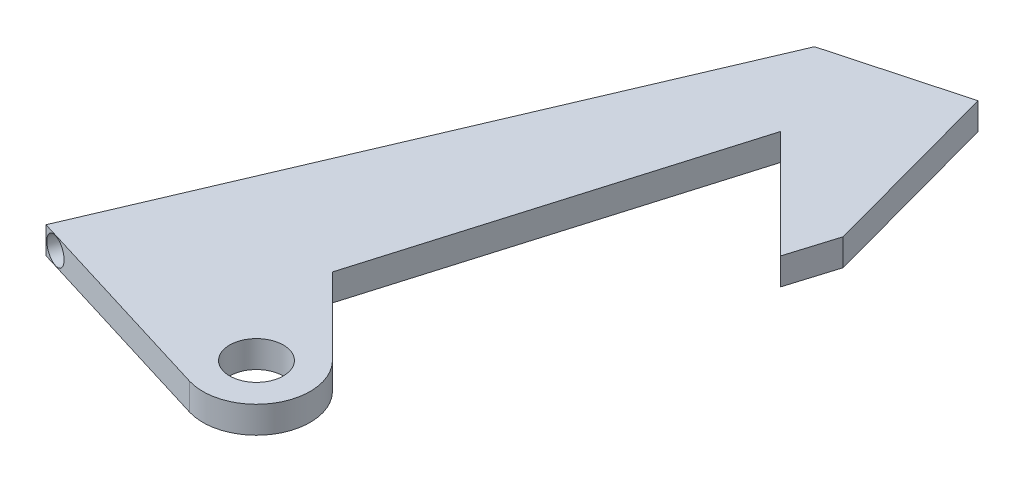
from build123d import *

# Parameters (mm, degrees)
SKETCH1_R                       = 4.7625
BOSS_EXTRUDE1_DEPTH             = 4.7625
F_14_0_182_DIAMETER_HOLE1_D     = 4.6228
F_14_0_182_DIAMETER_HOLE1_DEPTH = 2.54
F_14_0_182_DIAMETER_HOLE1_TIP   = 1.388829235


with BuildPart() as part:
    # Sketch1 → Boss-Extrude1 (new body)
    with BuildSketch(Plane(origin=(0, 0, 0), x_dir=(1, 0, 0), z_dir=(0, 1, 0))):
        with BuildLine():
            Line((16.483125125, 10.038536718), (1.944380626, 24.577281217))
            Line((1.944380626, 24.577281217), (-6.938453263, -5.410663424))
            Line((-6.938453263, -5.410663424), (-16.231323264, -36.782866781))
            Line((-16.231323264, -36.782866781), (-2.497585161, -50.51927236))
            ThreePointArc((-2.497585161, -50.51927236), (-1.253833938, -62.111786816), (-12.163673027, -66.223808166))
            Line((-12.163673027, -66.223808166), (-48.899522268, -54.933581589))
            Line((-48.899522268, -54.933581589), (-8.069891151, 40.604494765))
            Line((-8.069891151, 40.604494765), (14.731111048, 46.806223662))
            Line((14.731111048, 46.806223662), (15.992837223, 42.167417007))
            Line((15.992837223, 42.167417007), (23.669965833, 13.942025472))
            Line((23.669965833, 13.942025472), (21.070583439, 5.451078404))
            Line((21.070583439, 5.451078404), (16.483125125, 10.038536718))
        make_face()
        with Locations((-9.365474043, -57.119100184)):
            Circle(SKETCH1_R, mode=Mode.SUBTRACT)
    extrude(amount=BOSS_EXTRUDE1_DEPTH)

    # #14 (0.182) Diameter Hole1
    with Locations(Plane(origin=(-19.646161214, 0, 63.924174736), x_dir=(0.9558748537870817, 0, 0.29377417159703695), z_dir=(-0.29377417159703695, 0, 0.9558748537870817))):
        with Locations((-28.063756274, 2.38125)):
            Hole(F_14_0_182_DIAMETER_HOLE1_D / 2, depth=F_14_0_182_DIAMETER_HOLE1_DEPTH)
            with Locations((0, 0, -(F_14_0_182_DIAMETER_HOLE1_DEPTH + F_14_0_182_DIAMETER_HOLE1_TIP / 2))):  # 118° drill point
                Cone(0, F_14_0_182_DIAMETER_HOLE1_D / 2, F_14_0_182_DIAMETER_HOLE1_TIP, mode=Mode.SUBTRACT)


solid = part.part
